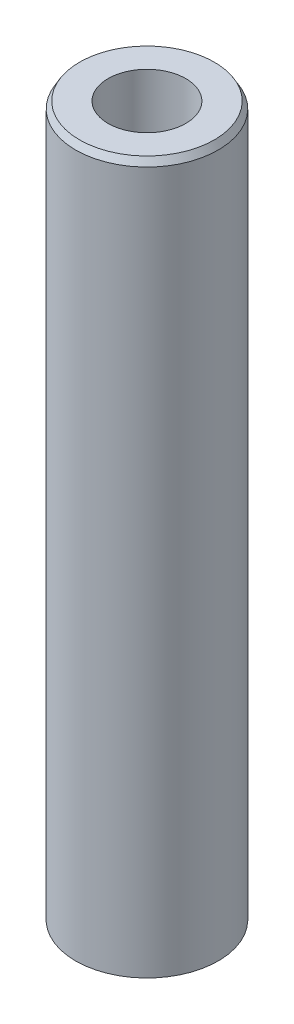
from build123d import *
from OCP.BRepFilletAPI import BRepFilletAPI_MakeChamfer

# Parameters (mm, degrees)
SKETCH1_R           = 60
BOSS_EXTRUDE1_DEPTH = 600
SKETCH2_R           = 32.721653865
CUT_EXTRUDE1_DEPTH  = 606.970296302
CHAMFER1_SIZE       = 5.727660807
CHAMFER1_SIZE2      = 3.306866509


with BuildPart() as part:
    # Sketch1 → Boss-Extrude1 (new body)
    with BuildSketch(Plane(origin=(0, 0, 0), x_dir=(1, 0, 0), z_dir=(0, 1, 0))):
        Circle(SKETCH1_R)
    extrude(amount=BOSS_EXTRUDE1_DEPTH)

    # Sketch2 → Cut-Extrude1 (cut, through all)
    with BuildSketch(Plane(origin=(0, 0, 0), x_dir=(1, 0, 0), z_dir=(0, 1, 0))):
        Circle(SKETCH2_R)
    extrude(amount=CUT_EXTRUDE1_DEPTH, mode=Mode.SUBTRACT)

    # Chamfer1: one chamfer whose edges measure the first distance from different faces: ONE call of the kernel's chamfer builder (chamfer() names one face for all edges)
    chamfer1_edges_1 = [part.edges().sort_by_distance(p)[0] for p in [
        (-60, 600, 0),
    ]]
    chamfer1_side_1 = [part.faces().sort_by_distance(p)[0] for p in [
        (-60, 300, 0),
    ]]
    chamfer1_edges_2 = [part.edges().sort_by_distance(p)[0] for p in [
        (-60, 0, 0),
    ]]
    chamfer1_side_2 = [part.faces().sort_by_distance(p)[0] for p in [
        (-58.302943725, 0, 0),
    ]]
    chamfer1 = BRepFilletAPI_MakeChamfer(part.part.solid().wrapped)
    for e in chamfer1_edges_1:
        chamfer1.Add(CHAMFER1_SIZE, CHAMFER1_SIZE2, e.wrapped, chamfer1_side_1[0].wrapped)  # the first distance lies on this face
    for e in chamfer1_edges_2:
        chamfer1.Add(CHAMFER1_SIZE, CHAMFER1_SIZE2, e.wrapped, chamfer1_side_2[0].wrapped)  # the first distance lies on this face
    add(Compound.cast(chamfer1.Shape()), mode=Mode.REPLACE)


solid = part.part
